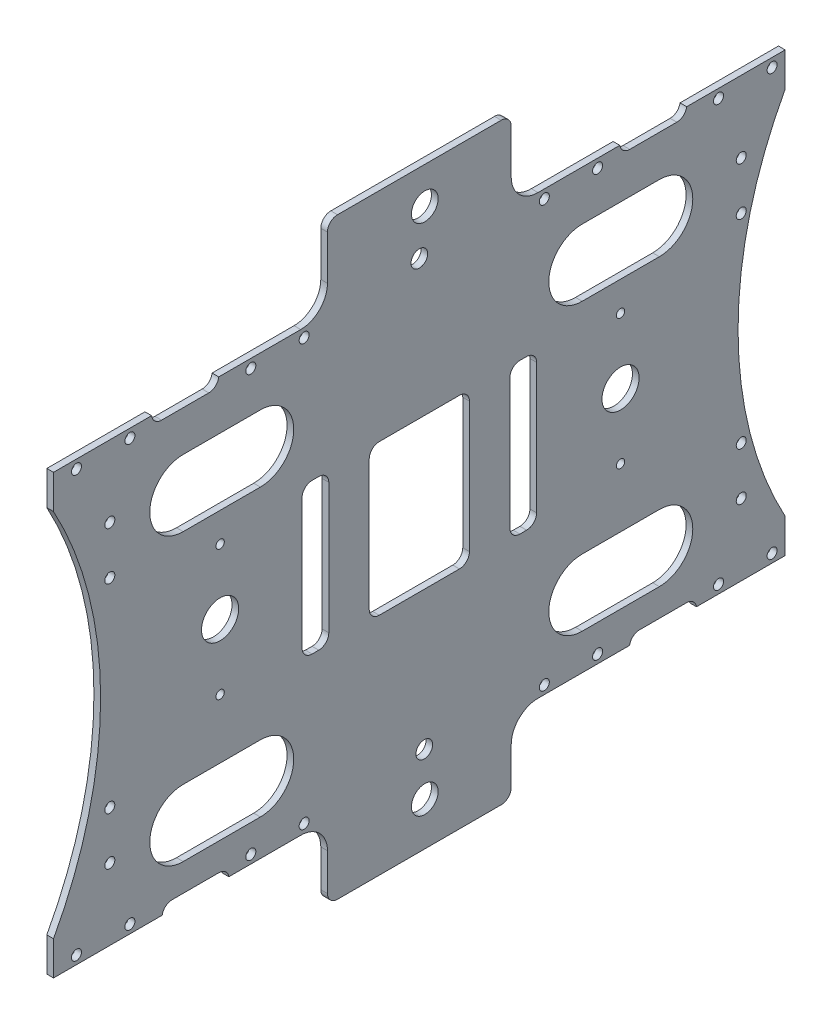
from build123d import *

# Parameters (mm, degrees)
SKETCH1_W           = 219
SKETCH1_H           = 131.094554082
BOSS_EXTRUDE1_DEPTH = 2
SKETCH2_R           = 1.5
CUT_EXTRUDE1_DEPTH  = 2
SKETCH3_W           = 20.100718227
SKETCH3_H           = 5.311130235
SKETCH3_W_2         = 20.021358258
SKETCH3_H_2         = 5.064277487
SKETCH3_W_3         = 19.940859064
SKETCH3_H_3         = 5.08276585
SKETCH3_W_4         = 20.006641617
SKETCH3_H_4         = 5.082063379
CUT_EXTRUDE2_DEPTH  = 2
FILLET1_R           = 3
SKETCH4_R           = 1.5
CUT_EXTRUDE3_DEPTH  = 2
SKETCH5_R           = 1.25
SKETCH5_R_2         = 5.565132804
SKETCH5_W           = 8
SKETCH5_H           = 45
CUT_EXTRUDE4_DEPTH  = 10
SKETCH6_W           = 55
SKETCH6_H           = 54.456850543
BOSS_EXTRUDE2_DEPTH = 2
FILLET2_R           = 8
FILLET3_R           = 3
SKETCH7_R           = 4
CUT_EXTRUDE5_DEPTH  = 10
SKETCH8_R           = 2.5
CUT_EXTRUDE6_DEPTH  = 3
FILLET4_R           = 3


with BuildPart() as part:
    # Sketch1 → Boss-Extrude1 (new body)
    with BuildSketch(Plane(origin=(0, 0, 0), x_dir=(0, 0, -1), z_dir=(1, 0, 0))):
        with Locations((-74.644772092, 21.741964745)):
            Rectangle(SKETCH1_W, SKETCH1_H)
    extrude(amount=BOSS_EXTRUDE1_DEPTH)

    # Sketch2 → Cut-Extrude1 (cut)
    with BuildSketch(Plane(origin=(2, 0, 0), x_dir=(0, 0, -1), z_dir=(1, 0, 0))):
        with Locations((-177.27818527, 84.689917601)):
            Circle(SKETCH2_R)
        with Locations((-161.277258525, 84.689917601)):
            Circle(SKETCH2_R)
        with Locations((14.907270265, 84.689917601)):
            Circle(SKETCH2_R)
        with Locations((30.940170054, 84.689917601)):
            Circle(SKETCH2_R)
        with Locations((-125.090896887, 84.689917601)):
            Circle(SKETCH2_R)
        with Locations((-109.121189232, 84.689917601)):
            Circle(SKETCH2_R)
        with Locations((-37.23969182, 84.689917601)):
            Circle(SKETCH2_R)
        with Locations((-21.290294086, 84.689917601)):
            Circle(SKETCH2_R)
        with Locations((-177.27818527, -41.255743067)):
            Circle(SKETCH2_R)
        with Locations((-161.277258525, -41.255743067)):
            Circle(SKETCH2_R)
        with Locations((-125.090896887, -41.255743067)):
            Circle(SKETCH2_R)
        with Locations((-109.121189232, -41.255743067)):
            Circle(SKETCH2_R)
        with Locations((-21.290294086, -41.255743067)):
            Circle(SKETCH2_R)
        with Locations((-37.23969182, -41.255743067)):
            Circle(SKETCH2_R)
        with Locations((14.907270265, -41.255743067)):
            Circle(SKETCH2_R)
        with Locations((30.940170054, -41.255743067)):
            Circle(SKETCH2_R)
    extrude(amount=-CUT_EXTRUDE1_DEPTH, mode=Mode.SUBTRACT)

    # Sketch3 → Cut-Extrude2 (cut)
    with BuildSketch(Plane(origin=(2, 0, 0), x_dir=(0, 0, -1), z_dir=(1, 0, 0))):
        with Locations((-144.733326963, 87.289241785)):
            Rectangle(SKETCH3_W, SKETCH3_H)
        with Locations((-4.626373242, 87.289241786)):
            Rectangle(SKETCH3_W_2, SKETCH3_H_2)
        with Locations((-141.63316605, -43.805312296)):
            Rectangle(SKETCH3_W_3, SKETCH3_H_3)
        with Locations((-1.696074774, -43.805312296)):
            Rectangle(SKETCH3_W_4, SKETCH3_H_4)
    extrude(amount=-CUT_EXTRUDE2_DEPTH, mode=Mode.SUBTRACT)

    # Fillet1
    # the kernel refuses this fillet: 3 mm, written as the material it adds along each edge
    with BuildSketch(Plane(origin=(2, 84.633676668, 154.783686076), x_dir=(0, 1, 0), z_dir=(-1, 0, 0))) as fillet1_piece_1:
        with BuildLine():
            CenterArc((3, 2.980161843), FILLET1_R, 180, 83.407239863)
            Line((0, 2.980161843), (-0.06, 2.980161843))
            Line((-0.06, 2.980161843), (-0.06, 0))
            Line((-0.06, 0), (0, -0.06))
            ThreePointArc((0, -0.06), (1.327782559, -0.06), (2.64867642, -0.059603237))
            Line((2.64867642, -0.059603237), (2.655565117, 0))
        make_face()
    extrude(amount=2)
    with BuildSketch(Plane(origin=(2, 84.633676668, 134.682967849), x_dir=(0, 1, 0), z_dir=(-1, 0, 0))) as fillet1_piece_2:
        with BuildLine():
            CenterArc((3, -2.980161843), FILLET1_R, 96.592760137, 83.407239863)
            Line((0, -2.980161843), (-0.06, -2.980161843))
            Line((-0.06, -2.980161843), (-0.06, 0))
            Line((-0.06, 0), (0, 0.06))
            ThreePointArc((0, 0.06), (1.327782559, 0.06), (2.64867642, 0.059603237))
            Line((2.64867642, 0.059603237), (2.655565117, 0))
        make_face()
    extrude(amount=2)
    with BuildSketch(Plane(origin=(2, 84.757103042, -5.384305887), x_dir=(0, 1, 0), z_dir=(-1, 0, 0))) as fillet1_piece_3:
        with BuildLine():
            CenterArc((3, -2.963293074), FILLET1_R, 98.972114931, 81.027885069)
            Line((0, -2.963293074), (-0.06, -2.963293074))
            Line((-0.06, -2.963293074), (-0.06, 0))
            Line((-0.06, 0), (0, 0.06))
            ThreePointArc((0, 0.06), (1.266069372, 0.06), (2.522781518, 0.059265861))
            Line((2.522781518, 0.059265861), (2.532138743, 0))
        make_face()
    extrude(amount=2)
    with BuildSketch(Plane(origin=(2, 84.757103042, 14.637052371), x_dir=(0, 0, -1), z_dir=(-1, 0, 0))) as fillet1_piece_4:
        with BuildLine():
            CenterArc((2.963293074, -3), FILLET1_R, 90, 81.027885069)
            Line((0, -2.532138743), (-0.059265861, -2.522781518))
            ThreePointArc((-0.059265861, -2.522781518), (-0.06, -1.266069372), (-0.06, 0))
            Line((-0.06, 0), (0, 0.06))
            Line((0, 0.06), (2.963293074, 0.06))
            Line((2.963293074, 0.06), (2.963293074, 0))
        make_face()
    extrude(amount=2)
    with BuildSketch(Plane(origin=(2, -41.264280606, 11.699395582), x_dir=(0, -1, 0), z_dir=(-1, 0, 0))) as fillet1_piece_5:
        with BuildLine():
            CenterArc((3, -2.964683472), FILLET1_R, 98.800208751, 81.199791249)
            Line((0, -2.964683472), (-0.06, -2.964683472))
            Line((-0.06, -2.964683472), (-0.06, 0))
            Line((-0.06, 0), (0, 0.06))
            ThreePointArc((0, 0.06), (1.270515845, 0.06), (2.531852323, 0.059293669))
            Line((2.531852323, 0.059293669), (2.54103169, 0))
        make_face()
    extrude(amount=2)
    with BuildSketch(Plane(origin=(2, -41.264280606, -8.307246035), x_dir=(0, 0, 1), z_dir=(-1, 0, 0))) as fillet1_piece_6:
        with BuildLine():
            CenterArc((2.964683472, -3), FILLET1_R, 90, 81.199791249)
            Line((0, -2.54103169), (-0.059293669, -2.531852323))
            ThreePointArc((-0.059293669, -2.531852323), (-0.06, -1.270515845), (-0.06, 0))
            Line((-0.06, 0), (0, 0.06))
            Line((0, 0.06), (2.964683472, 0.06))
            Line((2.964683472, 0.06), (2.964683472, 0))
        make_face()
    extrude(amount=2)
    with BuildSketch(Plane(origin=(2, -41.263929371, 131.662736518), x_dir=(0, 0, 1), z_dir=(-1, 0, 0))) as fillet1_piece_7:
        with BuildLine():
            CenterArc((2.964737826, -3), FILLET1_R, 90, 81.206579194)
            Line((0, -2.541382925), (-0.059294757, -2.532210583))
            ThreePointArc((-0.059294757, -2.532210583), (-0.06, -1.270691462), (-0.06, 0))
            Line((-0.06, 0), (0, 0.06))
            Line((0, 0.06), (2.964737826, 0.06))
            Line((2.964737826, 0.06), (2.964737826, 0))
        make_face()
    extrude(amount=2)
    with BuildSketch(Plane(origin=(2, -41.263929371, 151.603595582), x_dir=(0, -1, 0), z_dir=(-1, 0, 0))) as fillet1_piece_8:
        with BuildLine():
            CenterArc((3, -2.964737826), FILLET1_R, 98.793420806, 81.206579194)
            Line((0, -2.964737826), (-0.06, -2.964737826))
            Line((-0.06, -2.964737826), (-0.06, 0))
            Line((-0.06, 0), (0, 0.06))
            ThreePointArc((0, 0.06), (1.270691462, 0.06), (2.532210583, 0.059294757))
            Line((2.532210583, 0.059294757), (2.541382925, 0))
        make_face()
    extrude(amount=2)

    # Sketch4 → Cut-Extrude3 (cut)
    with BuildSketch(Plane(origin=(2, 0, 0), x_dir=(0, 0, -1), z_dir=(1, 0, 0))):
        with Locations((-167.296997749, 65.880164244)):
            Circle(SKETCH4_R)
        with Locations((-167.296997749, 51.515014112)):
            Circle(SKETCH4_R)
        with Locations((-167.296997749, -8.031084623)):
            Circle(SKETCH4_R)
        with Locations((-167.296997749, -22.396234754)):
            Circle(SKETCH4_R)
        with Locations((21.708416743, 65.880164244)):
            Circle(SKETCH4_R)
        with Locations((21.708416743, 51.515014112)):
            Circle(SKETCH4_R)
        with Locations((21.708416743, -8.031084623)):
            Circle(SKETCH4_R)
        with Locations((21.708416743, -22.396234754)):
            Circle(SKETCH4_R)
    extrude(amount=-CUT_EXTRUDE3_DEPTH, mode=Mode.SUBTRACT)

    # Sketch5 → Cut-Extrude4 (cut)
    with BuildSketch(Plane(origin=(2, 0, 0), x_dir=(0, 0, -1), z_dir=(1, 0, 0))):
        with Locations((-74.644772092, 42.276641696)):
            Circle(SKETCH5_R)
        with Locations((-74.644772092, 5.684578533)):
            Circle(SKETCH5_R)
        with Locations((-74.644772092, 23.980610114)):
            Circle(SKETCH5_R_2)
        with Locations((-14.415805331, 43.642669798)):
            Circle(SKETCH5_R)
        with Locations((-14.415805331, 4.642669798)):
            Circle(SKETCH5_R)
        with Locations((-14.415805331, 24.142669798)):
            Circle(SKETCH5_R_2)
        with Locations((-134.280651117, 43.746958038)):
            Circle(SKETCH5_R)
        with Locations((-134.280651117, 4.746958038)):
            Circle(SKETCH5_R)
        with Locations((-134.280651117, 24.246958038)):
            Circle(SKETCH5_R_2)
        with BuildLine():
            Line((-184.144772092, 77.115484366), (-184.144772092, -33.62266193))
            ThreePointArc((-184.144772092, -33.62266193), (-170.044992415, 21.746411218), (-184.144772092, 77.115484366))
        make_face()
        with BuildLine():
            Line((34.855227908, 77.115484366), (34.855227908, -33.62266193))
            ThreePointArc((34.855227908, -33.62266193), (20.755448231, 21.746411218), (34.855227908, 77.115484366))
        make_face()
        with BuildLine():
            Line((-25.897141257, 72.496877719), (-2.799065676, 72.496877719))
            ThreePointArc((-2.799065676, 72.496877719), (7.200934324, 62.496877719), (-2.799065676, 52.496877719))
            Line((-2.799065676, 52.496877719), (-25.897141257, 52.496877719))
            ThreePointArc((-25.897141257, 52.496877719), (-35.897141257, 62.496877719), (-25.897141257, 72.496877719))
        make_face()
        with BuildLine():
            Line((-25.897141257, -33.027821748), (-2.799065676, -33.027821748))
            ThreePointArc((-2.799065676, -33.027821748), (7.200934324, -23.027821748), (-2.799065676, -13.027821748))
            Line((-2.799065676, -13.027821748), (-25.897141257, -13.027821748))
            ThreePointArc((-25.897141257, -13.027821748), (-35.897141257, -23.027821748), (-25.897141257, -33.027821748))
        make_face()
        with BuildLine():
            Line((-122.237776037, 72.496877719), (-145.335851618, 72.496877719))
            ThreePointArc((-145.335851618, 72.496877719), (-155.335851618, 62.496877719), (-145.335851618, 52.496877719))
            Line((-145.335851618, 52.496877719), (-122.237776037, 52.496877719))
            ThreePointArc((-122.237776037, 52.496877719), (-112.237776037, 62.496877719), (-122.237776037, 72.496877719))
        make_face()
        with BuildLine():
            Line((-122.237776037, -33.027821748), (-145.335851618, -33.027821748))
            ThreePointArc((-145.335851618, -33.027821748), (-155.335851618, -23.027821748), (-145.335851618, -13.027821748))
            Line((-145.335851618, -13.027821748), (-122.237776037, -13.027821748))
            ThreePointArc((-122.237776037, -13.027821748), (-112.237776037, -23.027821748), (-122.237776037, -33.027821748))
        make_face()
        with Locations((-105.747084182, 23.980610114)):
            Rectangle(SKETCH5_W, SKETCH5_H)
        with Locations((-43.542460001, 23.980610114)):
            Rectangle(SKETCH5_W, SKETCH5_H)
    extrude(amount=-CUT_EXTRUDE4_DEPTH, mode=Mode.SUBTRACT)

    # Sketch6 → Boss-Extrude2 (add)
    with BuildSketch(Plane(origin=(2, 0, 0), x_dir=(0, 0, -1), z_dir=(1, 0, 0))):
        with Locations((-74.644772092, 84.319953677)):
            Rectangle(SKETCH6_W, SKETCH6_H)
        with Locations((-74.644772092, -38.682270845)):
            Rectangle(SKETCH6_W, SKETCH6_H)
    extrude(amount=-BOSS_EXTRUDE2_DEPTH)

    # Fillet2
    fillet2_edges = [part.edges().sort_by_distance(p)[0] for p in [
        (1, 87.289241786, 47.144772092),
        (1, 87.289241786, 102.144772092),
        (1, -43.805312296, 102.144772092),
        (1, -43.805312296, 47.144772092),
    ]]
    fillet(fillet2_edges, radius=FILLET2_R)

    # Fillet3
    fillet3_edges = [part.edges().sort_by_distance(p)[0] for p in [
        (1, 111.548378948, 47.144772092),
        (1, 111.548378948, 102.144772092),
        (1, -65.910696116, 102.144772092),
        (1, -65.910696116, 47.144772092),
    ]]
    fillet(fillet3_edges, radius=FILLET3_R)

    # Sketch7 → Cut-Extrude5 (cut)
    with BuildSketch(Plane(origin=(2, 0, 0), x_dir=(0, 0, -1), z_dir=(1, 0, 0))):
        with Locations((-73.016623219, 100.664626398)):
            Circle(SKETCH7_R)
        with Locations((-73.016623219, -52.991297145)):
            Circle(SKETCH7_R)
    extrude(amount=-CUT_EXTRUDE5_DEPTH, mode=Mode.SUBTRACT)

    # Sketch8 → Cut-Extrude6 (cut)
    with BuildSketch(Plane(origin=(2, 0, 0), x_dir=(0, 0, -1), z_dir=(1, 0, 0))):
        with Locations((-74.644772092, 87.980610114)):
            Circle(SKETCH8_R)
        with Locations((-73.162232803, -40.019389886)):
            Circle(SKETCH8_R)
        with BuildLine():
            Line((-86.644772092, 46.480610114), (-62.644772092, 46.480610114))
            ThreePointArc((-62.644772092, 46.480610114), (-60.523451748, 45.601930458), (-59.644772092, 43.480610114))
            Line((-59.644772092, 43.480610114), (-59.644772092, 4.480610114))
            ThreePointArc((-59.644772092, 4.480610114), (-60.523451748, 2.359289771), (-62.644772092, 1.480610114))
            Line((-62.644772092, 1.480610114), (-86.644772092, 1.480610114))
            ThreePointArc((-86.644772092, 1.480610114), (-88.766092435, 2.359289771), (-89.644772092, 4.480610114))
            Line((-89.644772092, 4.480610114), (-89.644772092, 43.480610114))
            ThreePointArc((-89.644772092, 43.480610114), (-88.766092435, 45.601930458), (-86.644772092, 46.480610114))
        make_face()
    extrude(amount=-CUT_EXTRUDE6_DEPTH, mode=Mode.SUBTRACT)

    # Fillet4
    fillet4_edges = [part.edges().sort_by_distance(p)[0] for p in [
        (1, 46.480610114, 101.747084182),
        (1, 1.480610114, 101.747084182),
        (1, 1.480610114, 109.747084182),
        (1, 46.480610114, 109.747084182),
        (1, 1.480610114, 47.542460001),
        (1, 46.480610114, 47.542460001),
        (1, 46.480610114, 39.542460001),
        (1, 1.480610114, 39.542460001),
    ]]
    fillet(fillet4_edges, radius=FILLET4_R)


solid = part.part
